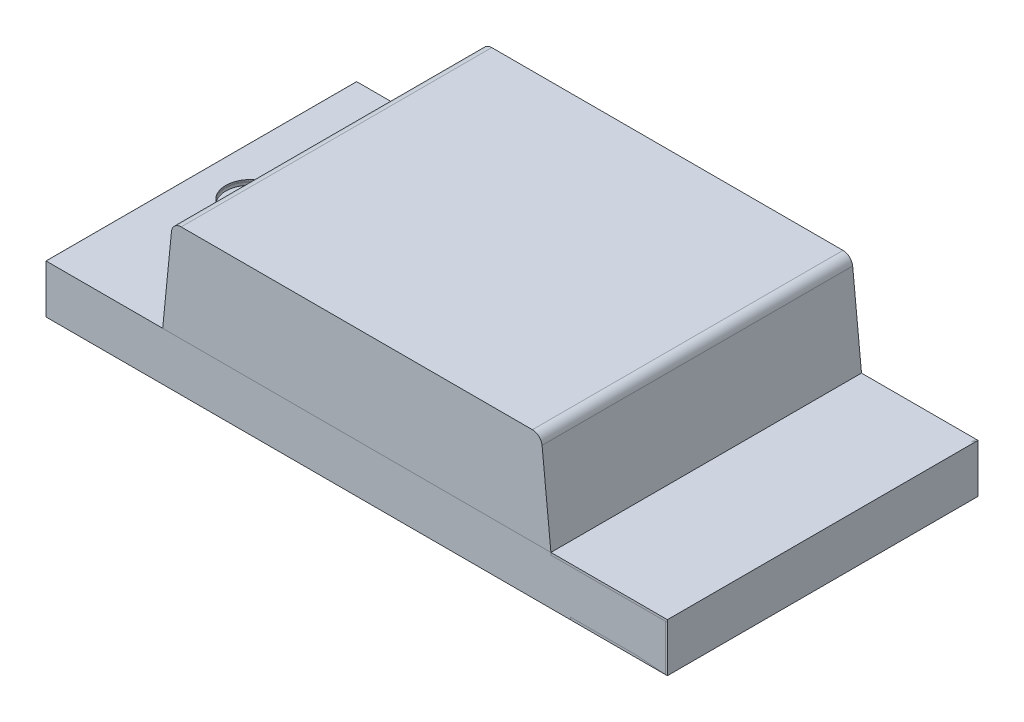
from build123d import *

# Parameters (mm, degrees)
SKETCH1_W                  = 3.2
SKETCH1_H                  = 0.25
EXTRUDE1_DEPTH             = 0.8
EXTRUDE2_DEPTH             = 0.8
EXTRUDE3_START             = -0.013
EXTRUDE3_DEPTH             = 0.0131
EXTRUDE4_DEPTH             = 0.0001
EXTRUDE4_DEPTH_BACK        = 0.012
SKETCH2_3_W                = 0.5
SKETCH2_3_H                = 1.6
EXTRUDE4_2_DEPTH           = 0.0001
EXTRUDE4_2_DEPTH_BACK      = 0.012
EXTRUDE5_DEPTH             = 0.0001
EXTRUDE5_DEPTH_BACK        = 0.012
SKETCH3_W                  = 0.6
SKETCH3_H                  = 1.6
EXTRUDE5_2_DEPTH           = 0.0001
EXTRUDE5_2_DEPTH_BACK      = 0.012
FILLET1_R                  = 0.05
EXTRUDE6_DEPTH             = 0.0001
EXTRUDE6_DEPTH_BACK        = 0.01
SKETCH5_W                  = 1.6
SKETCH5_H                  = 0.2501
EXTRUDE7_DEPTH             = 0.001
EXTRUDE7_DEPTH_BACK        = 0.01
SKETCH6_W                  = 1.6
SKETCH6_H                  = 0.25
SKETCH8_R                  = 0.05
EXTRUDE_PWB_LOCATION_DEPTH = 0.1
SKETCH9_R                  = 0.125
CUT_EXTRUDE2_DEPTH         = 0.0254


# Read off the part's stored shape, not the designer's step: Extrude3
with BuildPart() as part:
    # Sketch1 → Extrude1 (new, symmetric)
    with BuildSketch(Plane.XY):
        Rectangle(SKETCH1_W, SKETCH1_H)
    extrude(amount=EXTRUDE1_DEPTH, both=True)


with BuildPart() as body_2:
    # Sketch1<3> → Extrude2 (new, symmetric)
    with BuildSketch(Plane.XY):
        Polygon((-0.95, 0.625), (-1, 0.125), (1, 0.125), (0.95, 0.625), align=None)
    extrude(amount=EXTRUDE2_DEPTH, both=True)

    # Fillet1
    fillet1_edges = [body_2.edges().sort_by_distance(p)[0] for p in [
        (0.95, 0.625, 0),
        (-0.95, 0.625, 0),
    ]]
    fillet(fillet1_edges, radius=FILLET1_R)


with BuildPart() as body_3:
    # Extrude3 outline → Extrude3 (new body)
    with BuildSketch(Plane.XZ.offset(0.125).offset(EXTRUDE3_START)):
        Polygon((-0.399092971, 0.230883574), (-0.399092971, 0.8), (-0.824792139, 0.8), (-0.824792139, -0.8), (-0.399092971, -0.8), (-0.399092971, -0.230883574), (0.781254724, -0.230883574), (0.781254724, 0.230883574), align=None)
    extrude(amount=EXTRUDE3_DEPTH)


with BuildPart() as body_4:
    # Sketch2<3> → Extrude4 (new, two sides: drawn at the far end of the back side and taken through both)
    with BuildSketch(Plane.XZ.offset(0.125).offset(-EXTRUDE4_DEPTH_BACK)):
        with Locations((-1.35, 0)):
            Rectangle(SKETCH2_3_W, SKETCH2_3_H)
    extrude(amount=EXTRUDE4_DEPTH + EXTRUDE4_DEPTH_BACK)


with BuildPart() as body_5:
    # Sketch2<3> → Extrude4 2 (new, two sides: drawn at the far end of the back side and taken through both)
    with BuildSketch(Plane.XZ.offset(0.125).offset(-EXTRUDE4_2_DEPTH_BACK)):
        with Locations((1.35, 0)):
            Rectangle(SKETCH2_3_W, SKETCH2_3_H)
    extrude(amount=EXTRUDE4_2_DEPTH + EXTRUDE4_2_DEPTH_BACK)


with BuildPart() as body_6:
    # Sketch3 → Extrude5 (new, two sides: drawn at the far end of the back side and taken through both)
    with BuildSketch(Plane(origin=(0, 0.125, 0), x_dir=(-1, 0, 0), z_dir=(0, 1, 0)).offset(-EXTRUDE5_DEPTH_BACK)):
        with Locations((1.3, 0)):
            Rectangle(SKETCH3_W, SKETCH3_H)
    extrude(amount=EXTRUDE5_DEPTH + EXTRUDE5_DEPTH_BACK)


with BuildPart() as body_7:
    # Sketch3 → Extrude5 2 (new, two sides: drawn at the far end of the back side and taken through both)
    with BuildSketch(Plane(origin=(0, 0.125, 0), x_dir=(-1, 0, 0), z_dir=(0, 1, 0)).offset(-EXTRUDE5_2_DEPTH_BACK)):
        with Locations((-1.3, 0)):
            Rectangle(SKETCH3_W, SKETCH3_H)
    extrude(amount=EXTRUDE5_2_DEPTH + EXTRUDE5_2_DEPTH_BACK)


with BuildPart() as body_8:
    # Sketch5 → Extrude6 (new, two sides: drawn at the far end of the back side and taken through both)
    with BuildSketch(Plane(origin=(1.6, 0, 0), x_dir=(0, 0, -1), z_dir=(1, 0, 0)).offset(-EXTRUDE6_DEPTH_BACK)):
        with Locations((0, 5e-05)):
            Rectangle(SKETCH5_W, SKETCH5_H)
    extrude(amount=EXTRUDE6_DEPTH + EXTRUDE6_DEPTH_BACK)


with BuildPart() as body_9:
    # Sketch6 → Extrude7 (new, two sides: drawn at the far end of the back side and taken through both)
    with BuildSketch(Plane.ZY.offset(1.6).offset(-EXTRUDE7_DEPTH_BACK)):
        Rectangle(SKETCH6_W, SKETCH6_H)
    extrude(amount=EXTRUDE7_DEPTH + EXTRUDE7_DEPTH_BACK)


with BuildPart() as extrude_pwb_location_tool:
    # Sketch8 → Extrude PWB Location (new body)
    with BuildSketch(Plane.XZ.offset(0.1251)):
        with Locations(Location((0, 0, 0), (0, 0, 270))):
            Circle(SKETCH8_R)
    extrude(amount=-EXTRUDE_PWB_LOCATION_DEPTH)


with BuildPart() as part_1:
    add(part.part)

    # Extrude PWB Location: cut by extrude_pwb_location_tool
    add(extrude_pwb_location_tool.part, mode=Mode.SUBTRACT)


with BuildPart() as body_3_1:
    add(body_3.part)

    # Extrude PWB Location: cut by extrude_pwb_location_tool
    add(extrude_pwb_location_tool.part, mode=Mode.SUBTRACT)


with BuildPart() as cut_extrude2_tool:
    # Sketch9 → Cut-Extrude2 (new body)
    with BuildSketch(Plane(origin=(0, 0.1251, 0), x_dir=(1, 0, 0), z_dir=(0, 1, 0))):
        with Locations(Location((-1.35, 0, 0), (0, 0, 270))):
            Circle(SKETCH9_R)
    extrude(amount=-CUT_EXTRUDE2_DEPTH)


with BuildPart() as part_2:
    add(part_1.part)

    # Cut-Extrude2: cut by cut_extrude2_tool
    add(cut_extrude2_tool.part, mode=Mode.SUBTRACT)


with BuildPart() as body_6_1:
    add(body_6.part)

    # Cut-Extrude2: cut by cut_extrude2_tool
    add(cut_extrude2_tool.part, mode=Mode.SUBTRACT)


solid = Compound([body_2.part, body_4.part, body_5.part, body_7.part, body_8.part, body_9.part, body_3_1.part, part_2.part, body_6_1.part])
